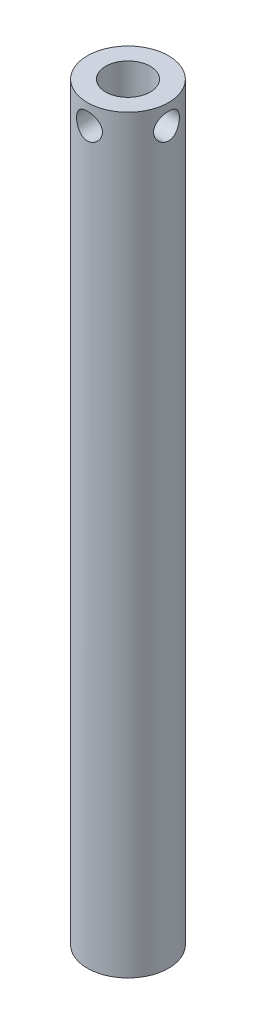
from build123d import *

# Parameters (mm, degrees)
SKETCH1_R                                 = 1
SKETCH1_R_2                               = 0.55
BOSS_EXTRUDE1_DEPTH                       = 18.47
F_72_0_025_DIAMETER_HOLE1_REACH           = 20.109
F_72_0_025_DIAMETER_HOLE1_BORE_R          = 0.3175
F_72_0_025_DIAMETER_HOLE1_ON_FACE_2_REACH = 20.109
F_72_0_025_DIAMETER_HOLE1_BORE_2_R        = 0.3175
F_54_0_055_DIAMETER_HOLE1_D               = 1.397
F_54_0_055_DIAMETER_HOLE1_DEPTH           = 4
F_54_0_055_DIAMETER_HOLE1_TIP             = 0.419701142


with BuildPart() as part:
    # Sketch1 → Boss-Extrude1 (new body)
    with BuildSketch(Plane(origin=(0, 0, 0), x_dir=(1, 0, 0), z_dir=(0, 1, 0))):
        Circle(SKETCH1_R)
        Circle(SKETCH1_R_2, mode=Mode.SUBTRACT)
    extrude(amount=BOSS_EXTRUDE1_DEPTH)

    # #72 (0.025) Diameter Hole1 bore (on position points) → #72 (0.025) Diameter Hole1 (cut, up to next)
    with BuildSketch(Plane(origin=(1, 17.97, 0), x_dir=(0, 0, 1), z_dir=(1, 0, 0)), mode=Mode.PRIVATE) as f_72_0_025_diameter_hole1_sk1:
        Circle(F_72_0_025_DIAMETER_HOLE1_BORE_R)
    f_72_0_025_diameter_hole1_tool1 = extrude(f_72_0_025_diameter_hole1_sk1.sketch, amount=-F_72_0_025_DIAMETER_HOLE1_REACH, mode=Mode.PRIVATE) & part.part
    add(f_72_0_025_diameter_hole1_tool1.solids().sort_by_distance((1, 17.97, 0))[0], mode=Mode.SUBTRACT)

    # #72 (0.025) Diameter Hole1 bore 2 (on position points) → #72 (0.025) Diameter Hole1 on face 2 (cut, up to next)
    with BuildSketch(Plane(origin=(0, 17.97, 1), x_dir=(1, 0, 0), z_dir=(0, 0, 1)), mode=Mode.PRIVATE) as f_72_0_025_diameter_hole1_on_face_2_sk1:
        Circle(F_72_0_025_DIAMETER_HOLE1_BORE_2_R)
    f_72_0_025_diameter_hole1_on_face_2_tool1 = extrude(f_72_0_025_diameter_hole1_on_face_2_sk1.sketch, amount=-F_72_0_025_DIAMETER_HOLE1_ON_FACE_2_REACH, mode=Mode.PRIVATE) & part.part
    add(f_72_0_025_diameter_hole1_on_face_2_tool1.solids().sort_by_distance((0, 17.97, 1))[0], mode=Mode.SUBTRACT)

    # #54 (0.055) Diameter Hole1
    with Locations(Plane(origin=(0, 0, 0), x_dir=(-1, 0, 0), z_dir=(0, -1, 0))):
        with Locations((0, 0)):
            Hole(F_54_0_055_DIAMETER_HOLE1_D / 2, depth=F_54_0_055_DIAMETER_HOLE1_DEPTH)
            with Locations((0, 0, -(F_54_0_055_DIAMETER_HOLE1_DEPTH + F_54_0_055_DIAMETER_HOLE1_TIP / 2))):  # 118° drill point
                Cone(0, F_54_0_055_DIAMETER_HOLE1_D / 2, F_54_0_055_DIAMETER_HOLE1_TIP, mode=Mode.SUBTRACT)


solid = part.part
